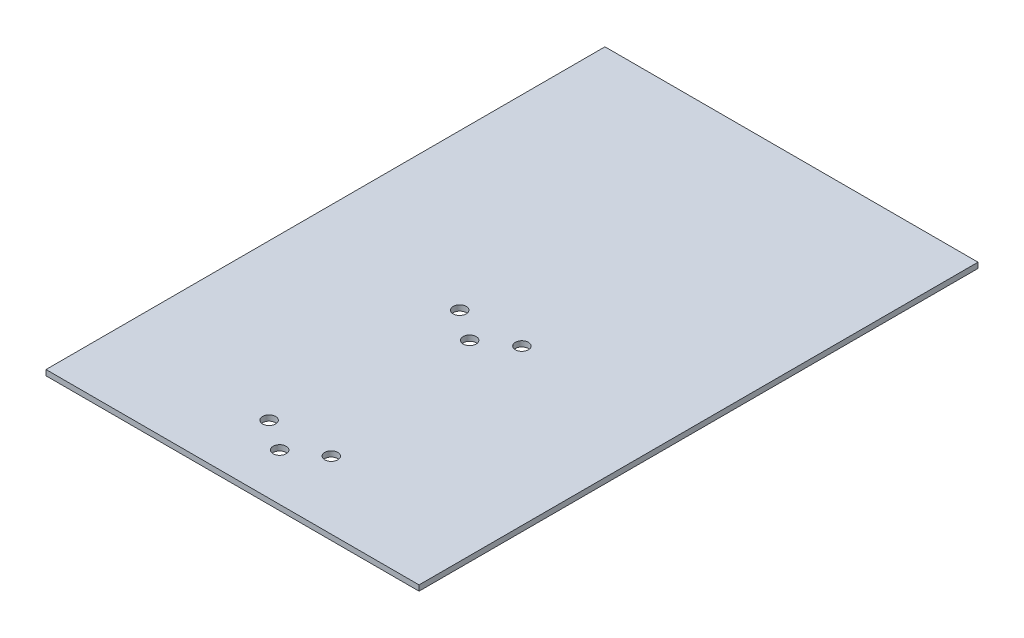
from build123d import *

# Parameters (mm, degrees)
SKETCH1_W           = 76.2
SKETCH1_H           = 114.173
BOSS_EXTRUDE1_DEPTH = 1.1176
SKETCH2_R           = 1.3335
CUT_EXTRUDE1_DEPTH  = 2.54


with BuildPart() as part:
    # Sketch1 → Boss-Extrude1 (new body)
    with BuildSketch(Plane(origin=(0, 0, 0), x_dir=(1, 0, 0), z_dir=(0, 1, 0))):
        with Locations((38.1, 57.0865)):
            Rectangle(SKETCH1_W, SKETCH1_H)
    extrude(amount=BOSS_EXTRUDE1_DEPTH)

    # Sketch2 → Cut-Extrude1 (cut)
    with BuildSketch(Plane(origin=(0, 1.1176, 0), x_dir=(1, 0, 0), z_dir=(0, 1, 0))):
        with Locations((31.75, 13.8176)):
            Circle(SKETCH2_R)
        with Locations((44.45, 13.8176)):
            Circle(SKETCH2_R)
        with Locations((38.1, 9.6266)):
            Circle(SKETCH2_R)
        with Locations((31.75, 52.7558)):
            Circle(SKETCH2_R)
        with Locations((44.45, 52.7558)):
            Circle(SKETCH2_R)
        with Locations((38.1, 48.4378)):
            Circle(SKETCH2_R)
    extrude(amount=-CUT_EXTRUDE1_DEPTH, mode=Mode.SUBTRACT)


solid = part.part
